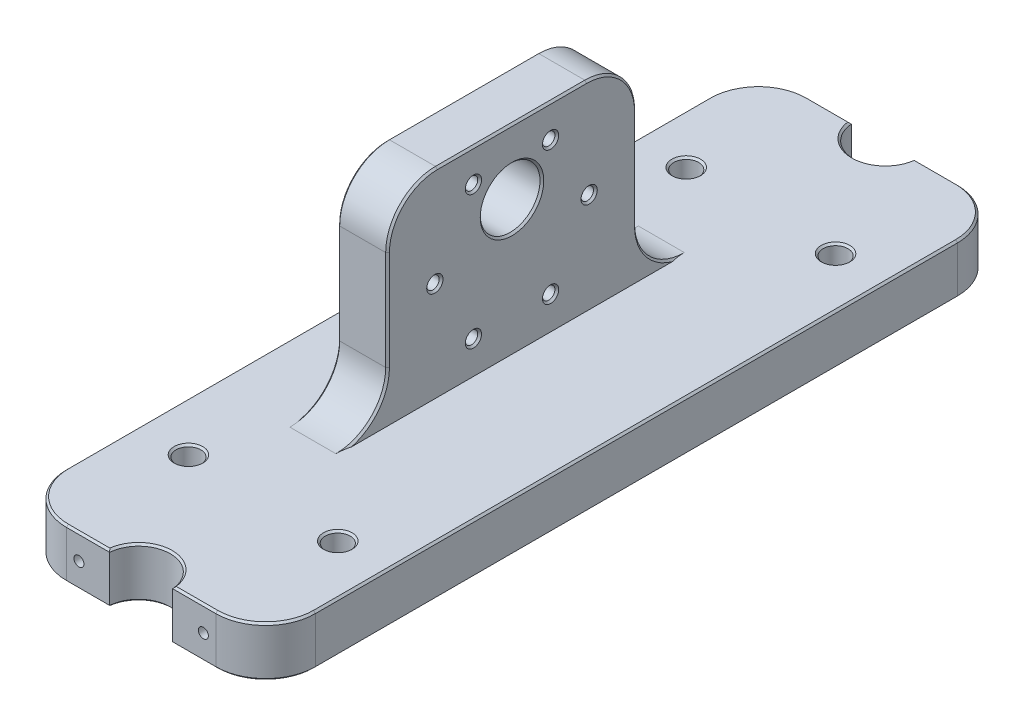
from build123d import *

# Parameters (mm, degrees)
SKETCH1_R           = 2.5
BOSS_EXTRUDE1_DEPTH = 10
SKETCH2_W           = 10
SKETCH2_H           = 50
BOSS_EXTRUDE2_DEPTH = 50
SKETCH3_R           = 1.25
SKETCH3_R_2         = 6
CUT_EXTRUDE1_DEPTH  = 103.714409895
FILLET1_R           = 10
SKETCH4_R           = 1
CUT_EXTRUDE2_DEPTH  = 5
CUT_EXTRUDE3_START  = -144
SKETCH4_2_R         = 1
CUT_EXTRUDE3_DEPTH  = 5
CHAMFER1_SIZE       = 0.381


with BuildPart() as part:
    # Sketch1 → Boss-Extrude1 (new body)
    with BuildSketch(Plane(origin=(0, 0, 0), x_dir=(1, 0, 0), z_dir=(0, 1, 0))):
        with BuildLine():
            Line((-25, 74.5), (-25, -74.5))
            Line((-25, -74.5), (-6.330284354, -74.5))
            ThreePointArc((-6.330284354, -74.5), (0, -68.65), (6.330284354, -74.5))
            Line((6.330284354, -74.5), (25, -74.5))
            Line((25, -74.5), (25, -17))
            Line((25, -17), (25, 17))
            Line((25, 17), (25, 74.5))
            Line((25, 74.5), (6.330284354, 74.5))
            ThreePointArc((6.330284354, 74.5), (0, 68.65), (-6.330284354, 74.5))
            Line((-6.330284354, 74.5), (-25, 74.5))
        make_face()
        with Locations(Location((-15, -50, 0), (0, 0, 270))):
            Circle(SKETCH1_R, mode=Mode.SUBTRACT)
        with Locations(Location((15, -50, 0), (0, 0, 270))):
            Circle(SKETCH1_R, mode=Mode.SUBTRACT)
        with Locations(Location((-15, 50, 0), (0, 0, 270))):
            Circle(SKETCH1_R, mode=Mode.SUBTRACT)
        with Locations(Location((15, 50, 0), (0, 0, 270))):
            Circle(SKETCH1_R, mode=Mode.SUBTRACT)
    extrude(amount=BOSS_EXTRUDE1_DEPTH)

    # Sketch2 → Boss-Extrude2 (add)
    with BuildSketch(Plane(origin=(0, 0, 0), x_dir=(1, 0, 0), z_dir=(0, 1, 0))):
        with Locations((-5, 0)):
            Rectangle(SKETCH2_W, SKETCH2_H)
    extrude(amount=BOSS_EXTRUDE2_DEPTH)

    # Sketch3 → Cut-Extrude1 (cut, through all)
    with BuildSketch(Plane(origin=(25, 0, 0), x_dir=(0, 0, -1), z_dir=(1, 0, 0))):
        with Locations((-15.5, 30)):
            Circle(SKETCH3_R)
        with Locations((0, 37)):
            Circle(SKETCH3_R_2)
        with Locations((-7.75, 43.423393759)):
            Circle(SKETCH3_R)
        with Locations((7.75, 43.423393759)):
            Circle(SKETCH3_R)
        with Locations((15.5, 30)):
            Circle(SKETCH3_R)
        with Locations((7.75, 16.576606241)):
            Circle(SKETCH3_R)
        with Locations((-7.75, 16.576606241)):
            Circle(SKETCH3_R)
    extrude(amount=-CUT_EXTRUDE1_DEPTH, mode=Mode.SUBTRACT)

    # Fillet1
    fillet1_edges = [part.edges().sort_by_distance(p)[0] for p in [
        (-25, 5, 74.5),
        (-25, 5, -74.5),
        (25, 5, -74.5),
        (25, 5, 74.5),
        (-5, 10, -25),
        (-5, 10, 25),
        (-5, 50, -25),
        (-5, 50, 25),
    ]]
    fillet(fillet1_edges, radius=FILLET1_R)

    # Sketch4 → Cut-Extrude2 (cut)
    with BuildSketch(Plane.XY.offset(74.5)):
        with Locations((-12.5, 5)):
            Circle(SKETCH4_R)
        with Locations((12.5, 5)):
            Circle(SKETCH4_R)
    extrude(amount=-CUT_EXTRUDE2_DEPTH, mode=Mode.SUBTRACT)

    # Sketch4<2> → Cut-Extrude3 (cut)
    with BuildSketch(Plane.XY.offset(74.5).offset(CUT_EXTRUDE3_START)):
        with Locations((-12.5, 5)):
            Circle(SKETCH4_2_R)
        with Locations((12.5, 5)):
            Circle(SKETCH4_2_R)
    extrude(amount=-CUT_EXTRUDE3_DEPTH, mode=Mode.SUBTRACT)

    # Chamfer1
    # the kernel refuses this chamfer: 0.381 mm, written as the material it takes off along each edge
    with BuildSketch(Plane(origin=(15, 10, -50), x_dir=(0, 0, 1), z_dir=(-1, 0, 0))) as chamfer1_piece_1:
        Polygon((2.5 + CHAMFER1_SIZE, 0), (2.5, -CHAMFER1_SIZE), (2.5, 0), align=None)
    revolve(axis=Axis((15, 10, -50), (0, 1, 0)), mode=Mode.SUBTRACT)
    with BuildSketch(Plane(origin=(-25, 0, -64.5), x_dir=(0.9996219169112966, -0.027495876610586445, 0), z_dir=(0, 0, 1)), Plane(origin=(25, 0, 64.5), x_dir=(-0.9996219169112966, -0.0274958766105867, 0), z_dir=(0, 0, -1)), Plane(origin=(25, 10, -64.5), x_dir=(-0.9996219169112966, 0.027495876610587368, 0), z_dir=(0, 0, 1))) as chamfer1_piece_2:
        Polygon((CHAMFER1_SIZE * 0.999621916911, CHAMFER1_SIZE * 0.0274958766106), (-CHAMFER1_SIZE * 0.0274958766106, CHAMFER1_SIZE * 0.999621916911), (0, 0), align=None)
    extrude(amount=129, mode=Mode.SUBTRACT)
    with BuildSketch(Plane(origin=(-25, 10, -64.5), x_dir=(0.9996219169112966, 0.027495876610587368, 0), z_dir=(0, 0, 1))) as chamfer1_piece_3:
        Polygon((CHAMFER1_SIZE * 0.999621916911, -CHAMFER1_SIZE * 0.0274958766106), (-CHAMFER1_SIZE * 0.0274958766106, -CHAMFER1_SIZE * 0.999621916911), (0, 0), align=None)
    extrude(amount=129, mode=Mode.SUBTRACT)
    with BuildSketch(Plane(origin=(-15, 0, 74.5), x_dir=(0, -0.027495876610586445, -0.9996219169112966), z_dir=(1, 0, 0)), Plane(origin=(-5.350473135, 0, -74.5), x_dir=(0, -0.027495876610586445, 0.9996219169112966), z_dir=(-1, 0, 0)), Plane(origin=(5.350473135, 0, 74.5), x_dir=(0, -0.027495876610586445, -0.9996219169112966), z_dir=(1, 0, 0)), Plane(origin=(15, 10, -74.5), x_dir=(0, -0.9996219169112968, -0.027495876610582715), z_dir=(-1, 0, 0))) as chamfer1_piece_4:
        Polygon((CHAMFER1_SIZE * 0.999621916911, CHAMFER1_SIZE * 0.0274958766106), (-CHAMFER1_SIZE * 0.0274958766106, CHAMFER1_SIZE * 0.999621916911), (0, 0), align=None)
    extrude(amount=9.649526865, mode=Mode.SUBTRACT)
    with BuildSketch(Plane(origin=(15, 0, 64.5), x_dir=(1, 0, 0), z_dir=(0, 0, -1))) as chamfer1_piece_5:
        Polygon((10 - CHAMFER1_SIZE, 0), (10, -CHAMFER1_SIZE), (10, 0), align=None)
    revolve(axis=Axis((15, 0, 64.5), (0, -1, 0)), revolution_arc=90, mode=Mode.SUBTRACT)
    with BuildSketch(Plane(origin=(-15, 0, 64.5), x_dir=(-1, 0, 0), z_dir=(0, 0, -1))) as chamfer1_piece_6:
        Polygon((10 - CHAMFER1_SIZE, 0), (10, CHAMFER1_SIZE), (10, 0), align=None)
    revolve(axis=Axis((-15, 0, 64.5), (0, 1, 0)), revolution_arc=90, mode=Mode.SUBTRACT)
    with BuildSketch(Plane(origin=(15, 0, -64.5), x_dir=(0, 0, -1), z_dir=(-1, 0, 0))) as chamfer1_piece_7:
        Polygon((10 - CHAMFER1_SIZE, 0), (10, -CHAMFER1_SIZE), (10, 0), align=None)
    revolve(axis=Axis((15, 0, -64.5), (0, -1, 0)), revolution_arc=90, mode=Mode.SUBTRACT)
    with BuildSketch(Plane(origin=(-15, 0, -64.5), x_dir=(0, 0, -1), z_dir=(1, 0, 0))) as chamfer1_piece_8:
        Polygon((10 - CHAMFER1_SIZE, 0), (10, CHAMFER1_SIZE), (10, 0), align=None)
    revolve(axis=Axis((-15, 0, -64.5), (0, 1, 0)), revolution_arc=90, mode=Mode.SUBTRACT)
    with BuildSketch(Plane(origin=(-5.350473135, 10, -74.5), x_dir=(0, 0.027495876610587368, 0.9996219169112966), z_dir=(-1, 0, 0)), Plane(origin=(-15, 10, 74.5), x_dir=(0, 0.027495876610587368, -0.9996219169112966), z_dir=(1, 0, 0)), Plane(origin=(15, 0, -74.5), x_dir=(0, 0.9996219169112968, -0.027495876610582753), z_dir=(-1, 0, 0)), Plane(origin=(5.350473135, 10, 74.5), x_dir=(0, 0.027495876610587368, -0.9996219169112966), z_dir=(1, 0, 0))) as chamfer1_piece_9:
        Polygon((CHAMFER1_SIZE * 0.999621916911, -CHAMFER1_SIZE * 0.0274958766106), (-CHAMFER1_SIZE * 0.0274958766106, -CHAMFER1_SIZE * 0.999621916911), (0, 0), align=None)
    extrude(amount=9.649526865, mode=Mode.SUBTRACT)
    with BuildSketch(Plane(origin=(15, 10, 64.5), x_dir=(1, 0, 0), z_dir=(0, 0, -1))) as chamfer1_piece_10:
        Polygon((10 - CHAMFER1_SIZE, 0), (10, CHAMFER1_SIZE), (10, 0), align=None)
    revolve(axis=Axis((15, 10, 64.5), (0, -1, 0)), revolution_arc=90, mode=Mode.SUBTRACT)
    with BuildSketch(Plane(origin=(-15, 10, 64.5), x_dir=(-1, 0, 0), z_dir=(0, 0, -1))) as chamfer1_piece_11:
        Polygon((10 - CHAMFER1_SIZE, 0), (10, -CHAMFER1_SIZE), (10, 0), align=None)
    revolve(axis=Axis((-15, 10, 64.5), (0, 1, 0)), revolution_arc=90, mode=Mode.SUBTRACT)
    with BuildSketch(Plane(origin=(15, 10, -64.5), x_dir=(0, 0, -1), z_dir=(-1, 0, 0))) as chamfer1_piece_12:
        Polygon((10, CHAMFER1_SIZE), (10 - CHAMFER1_SIZE, 0), (10, 0), align=None)
    revolve(axis=Axis((15, 10, -64.5), (0, -1, 0)), revolution_arc=90, mode=Mode.SUBTRACT)
    with BuildSketch(Plane(origin=(-15, 10, -64.5), x_dir=(0, 0, -1), z_dir=(1, 0, 0))) as chamfer1_piece_13:
        Polygon((10 - CHAMFER1_SIZE, 0), (10, -CHAMFER1_SIZE), (10, 0), align=None)
    revolve(axis=Axis((-15, 10, -64.5), (0, 1, 0)), revolution_arc=90, mode=Mode.SUBTRACT)
    with BuildSketch(Plane(origin=(-10, 20, -25), x_dir=(-0.027495876610587368, 0, 0.9996219169112966), z_dir=(0, 1, 0)), Plane(origin=(0, 20, 25), x_dir=(0.027495876610586268, 0, -0.9996219169112966), z_dir=(0, 1, 0))) as chamfer1_piece_14:
        Polygon((CHAMFER1_SIZE * 0.999621916911, CHAMFER1_SIZE * 0.0274958766106), (-CHAMFER1_SIZE * 0.0274958766106, CHAMFER1_SIZE * 0.999621916911), (0, 0), align=None)
    extrude(amount=20, mode=Mode.SUBTRACT)
    with BuildSketch(Plane(origin=(0, 20, -25), x_dir=(0.02749587661058663, 0, 0.9996219169112966), z_dir=(0, 1, 0)), Plane(origin=(-10, 20, 25), x_dir=(-0.027495876610587864, 0, -0.9996219169112966), z_dir=(0, 1, 0))) as chamfer1_piece_15:
        Polygon((CHAMFER1_SIZE * 0.999621916911, -CHAMFER1_SIZE * 0.0274958766106), (-CHAMFER1_SIZE * 0.0274958766106, -CHAMFER1_SIZE * 0.999621916911), (0, 0), align=None)
    extrude(amount=20, mode=Mode.SUBTRACT)
    with BuildSketch(Plane(origin=(0, 50, 15), x_dir=(0.027495876610586445, -0.9996219169112966, 0), z_dir=(0, 0, -1)), Plane(origin=(-10, 50, -15), x_dir=(-0.027495876610587368, -0.9996219169112966, 0), z_dir=(0, 0, 1))) as chamfer1_piece_16:
        Polygon((CHAMFER1_SIZE * 0.999621916911, CHAMFER1_SIZE * 0.0274958766106), (-CHAMFER1_SIZE * 0.0274958766106, CHAMFER1_SIZE * 0.999621916911), (0, 0), align=None)
    extrude(amount=30, mode=Mode.SUBTRACT)
    with BuildSketch(Plane(origin=(-10, 40, 15), x_dir=(0, 0, 1), z_dir=(0, -1, 0))) as chamfer1_piece_17:
        Polygon((10 - CHAMFER1_SIZE, 0), (10, -CHAMFER1_SIZE), (10, 0), align=None)
    revolve(axis=Axis((-10, 40, 15), (-1, 0, 0)), revolution_arc=90, mode=Mode.SUBTRACT)
    with BuildSketch(Plane(origin=(-10, 40, -15), x_dir=(0, 0, -1), z_dir=(0, -1, 0))) as chamfer1_piece_18:
        Polygon((10 - CHAMFER1_SIZE, 0), (10, CHAMFER1_SIZE), (10, 0), align=None)
    revolve(axis=Axis((-10, 40, -15), (1, 0, 0)), revolution_arc=90, mode=Mode.SUBTRACT)
    with BuildSketch(Plane(origin=(0, 40, 15), x_dir=(0, 0, 1), z_dir=(0, -1, 0))) as chamfer1_piece_19:
        Polygon((10 - CHAMFER1_SIZE, 0), (10, CHAMFER1_SIZE), (10, 0), align=None)
    revolve(axis=Axis((0, 40, 15), (-1, 0, 0)), revolution_arc=90, mode=Mode.SUBTRACT)
    with BuildSketch(Plane(origin=(0, 40, -15), x_dir=(0, 0, -1), z_dir=(0, -1, 0))) as chamfer1_piece_20:
        Polygon((10 - CHAMFER1_SIZE, 0), (10, -CHAMFER1_SIZE), (10, 0), align=None)
    revolve(axis=Axis((0, 40, -15), (1, 0, 0)), revolution_arc=90, mode=Mode.SUBTRACT)
    with BuildSketch(Plane(origin=(0, 20, -35), x_dir=(0, -0.9951998377707145, -0.09786359333860377), z_dir=(0, 0.09786359333860377, -0.9951998377707145))) as chamfer1_piece_21_section:
        Polygon((10, CHAMFER1_SIZE), (10 + CHAMFER1_SIZE, 0), (10, 0), align=None)
    chamfer1_piece_21 = revolve(axis=Axis((0, 20, -35), (-1, 0, 0)), revolution_arc=95.616159905, mode=Mode.PRIVATE)
    chamfer1_piece_21 = split(chamfer1_piece_21, bisect_by=Plane(origin=(-0.183576142, 10, -27.799124254), z_dir=(0, 1, 0)), keep=Keep.TOP, mode=Mode.PRIVATE)
    add(chamfer1_piece_21, mode=Mode.SUBTRACT)
    with BuildSketch(Plane(origin=(-10, 20, -35), x_dir=(0, -0.9951998377707145, -0.09786359333860377), z_dir=(0, 0.09786359333860377, -0.9951998377707145))) as chamfer1_piece_22_section:
        Polygon((10, -CHAMFER1_SIZE), (10 + CHAMFER1_SIZE, 0), (10, 0), align=None)
    chamfer1_piece_22 = revolve(axis=Axis((-10, 20, -35), (-1, 0, 0)), revolution_arc=95.616159905, mode=Mode.PRIVATE)
    chamfer1_piece_22 = split(chamfer1_piece_22, bisect_by=Plane(origin=(-9.816423858, 10, -27.799124254), z_dir=(0, 1, 0)), keep=Keep.TOP, mode=Mode.PRIVATE)
    add(chamfer1_piece_22, mode=Mode.SUBTRACT)
    with BuildSketch(Plane(origin=(-10, 20, 35), x_dir=(0, -0.9951998377707145, 0.09786359333860377), z_dir=(0, 0.09786359333860377, 0.9951998377707145))) as chamfer1_piece_23_section:
        Polygon((10, CHAMFER1_SIZE), (10 + CHAMFER1_SIZE, 0), (10, 0), align=None)
    chamfer1_piece_23 = revolve(axis=Axis((-10, 20, 35), (1, 0, 0)), revolution_arc=95.616159905, mode=Mode.PRIVATE)
    chamfer1_piece_23 = split(chamfer1_piece_23, bisect_by=Plane(origin=(-9.816423858, 10, 27.799124254), z_dir=(0, 1, 0)), keep=Keep.TOP, mode=Mode.PRIVATE)
    add(chamfer1_piece_23, mode=Mode.SUBTRACT)
    with BuildSketch(Plane(origin=(0, 20, 35), x_dir=(0, -0.9951998377707145, 0.09786359333860303), z_dir=(0, 0.09786359333860303, 0.9951998377707145))) as chamfer1_piece_24_section:
        Polygon((10 + CHAMFER1_SIZE, 0), (10, -CHAMFER1_SIZE), (10, 0), align=None)
    chamfer1_piece_24 = revolve(axis=Axis((0, 20, 35), (1, 0, 0)), revolution_arc=95.616159905, mode=Mode.PRIVATE)
    chamfer1_piece_24 = split(chamfer1_piece_24, bisect_by=Plane(origin=(-0.183576142, 10, 27.799124254), z_dir=(0, 1, 0)), keep=Keep.TOP, mode=Mode.PRIVATE)
    add(chamfer1_piece_24, mode=Mode.SUBTRACT)
    with BuildSketch(Plane(origin=(15, 10, 50), x_dir=(0, 0, 1), z_dir=(-1, 0, 0))) as chamfer1_piece_25:
        Polygon((2.5 + CHAMFER1_SIZE, 0), (2.5, -CHAMFER1_SIZE), (2.5, 0), align=None)
    revolve(axis=Axis((15, 10, 50), (0, 1, 0)), mode=Mode.SUBTRACT)
    with BuildSketch(Plane(origin=(0, 0, -75), x_dir=(0.9971358907761932, 0, -0.0756307829257876), z_dir=(-0.0756307829257876, 0, -0.9971358907761932))) as chamfer1_piece_26:
        Polygon((6.35 + CHAMFER1_SIZE, 0), (6.35, -CHAMFER1_SIZE), (6.35, 0), align=None)
    revolve(axis=Axis((0, 0, -75), (0, -1, 0)), revolution_arc=188.674932893, mode=Mode.SUBTRACT)
    with BuildSketch(Plane(origin=(0, 0, 75), x_dir=(-0.9971358907761962, 0, 0.07563078292574767), z_dir=(0.07563078292574767, 0, 0.9971358907761962))) as chamfer1_piece_27:
        Polygon((6.35 + CHAMFER1_SIZE, 0), (6.35, -CHAMFER1_SIZE), (6.35, 0), align=None)
    revolve(axis=Axis((0, 0, 75), (0, -1, 0)), revolution_arc=188.674932893, mode=Mode.SUBTRACT)
    with BuildSketch(Plane(origin=(-15, 0, -50), x_dir=(0, 0, 1), z_dir=(-1, 0, 0))) as chamfer1_piece_28:
        Polygon((2.5 + CHAMFER1_SIZE, 0), (2.5, CHAMFER1_SIZE), (2.5, 0), align=None)
    revolve(axis=Axis((-15, 0, -50), (0, 1, 0)), mode=Mode.SUBTRACT)
    with BuildSketch(Plane(origin=(-15, 0, 50), x_dir=(0, 0, 1), z_dir=(-1, 0, 0))) as chamfer1_piece_29:
        Polygon((2.5 + CHAMFER1_SIZE, 0), (2.5, CHAMFER1_SIZE), (2.5, 0), align=None)
    revolve(axis=Axis((-15, 0, 50), (0, 1, 0)), mode=Mode.SUBTRACT)
    with BuildSketch(Plane(origin=(15, 0, 50), x_dir=(0, 0, 1), z_dir=(-1, 0, 0))) as chamfer1_piece_30:
        Polygon((2.5 + CHAMFER1_SIZE, 0), (2.5, CHAMFER1_SIZE), (2.5, 0), align=None)
    revolve(axis=Axis((15, 0, 50), (0, 1, 0)), mode=Mode.SUBTRACT)
    with BuildSketch(Plane(origin=(15, 0, -50), x_dir=(0, 0, 1), z_dir=(-1, 0, 0))) as chamfer1_piece_31:
        Polygon((2.5 + CHAMFER1_SIZE, 0), (2.5, CHAMFER1_SIZE), (2.5, 0), align=None)
    revolve(axis=Axis((15, 0, -50), (0, 1, 0)), mode=Mode.SUBTRACT)
    with BuildSketch(Plane(origin=(-15, 10, 50), x_dir=(0, 0, 1), z_dir=(-1, 0, 0))) as chamfer1_piece_32:
        Polygon((2.5 + CHAMFER1_SIZE, 0), (2.5, -CHAMFER1_SIZE), (2.5, 0), align=None)
    revolve(axis=Axis((-15, 10, 50), (0, 1, 0)), mode=Mode.SUBTRACT)
    with BuildSketch(Plane(origin=(-15, 10, -50), x_dir=(0, 0, 1), z_dir=(-1, 0, 0))) as chamfer1_piece_33:
        Polygon((2.5 + CHAMFER1_SIZE, 0), (2.5, -CHAMFER1_SIZE), (2.5, 0), align=None)
    revolve(axis=Axis((-15, 10, -50), (0, 1, 0)), mode=Mode.SUBTRACT)
    with BuildSketch(Plane(origin=(0, 10, 75), x_dir=(-0.9971358907761962, 0, 0.07563078292574767), z_dir=(0.07563078292574767, 0, 0.9971358907761962))) as chamfer1_piece_34:
        Polygon((6.35 + CHAMFER1_SIZE, 0), (6.35, CHAMFER1_SIZE), (6.35, 0), align=None)
    revolve(axis=Axis((0, 10, 75), (0, -1, 0)), revolution_arc=188.674932893, mode=Mode.SUBTRACT)
    with BuildSketch(Plane(origin=(0, 10, -75), x_dir=(0.9971358907761932, 0, -0.0756307829257876), z_dir=(-0.0756307829257876, 0, -0.9971358907761932))) as chamfer1_piece_35:
        Polygon((6.35, CHAMFER1_SIZE), (6.35 + CHAMFER1_SIZE, 0), (6.35, 0), align=None)
    revolve(axis=Axis((0, 10, -75), (0, -1, 0)), revolution_arc=188.674932893, mode=Mode.SUBTRACT)
    with BuildSketch(Plane(origin=(-10, 30, 15.5), x_dir=(0, 0, -1), z_dir=(0, -1, 0))) as chamfer1_piece_36:
        Polygon((1.25 + CHAMFER1_SIZE, 0), (1.25, CHAMFER1_SIZE), (1.25, 0), align=None)
    revolve(axis=Axis((-10, 30, 15.5), (1, 0, 0)), mode=Mode.SUBTRACT)
    with BuildSketch(Plane(origin=(0, 30, 15.5), x_dir=(0, 0, -1), z_dir=(0, -1, 0))) as chamfer1_piece_37:
        Polygon((1.25 + CHAMFER1_SIZE, 0), (1.25, -CHAMFER1_SIZE), (1.25, 0), align=None)
    revolve(axis=Axis((0, 30, 15.5), (1, 0, 0)), mode=Mode.SUBTRACT)
    with BuildSketch(Plane(origin=(-10, 37, 0), x_dir=(0, 0, -1), z_dir=(0, -1, 0))) as chamfer1_piece_38:
        Polygon((6 + CHAMFER1_SIZE, 0), (6, CHAMFER1_SIZE), (6, 0), align=None)
    revolve(axis=Axis((-10, 37, 0), (1, 0, 0)), mode=Mode.SUBTRACT)
    with BuildSketch(Plane(origin=(0, 37, 0), x_dir=(0, 0, -1), z_dir=(0, -1, 0))) as chamfer1_piece_39:
        Polygon((6 + CHAMFER1_SIZE, 0), (6, -CHAMFER1_SIZE), (6, 0), align=None)
    revolve(axis=Axis((0, 37, 0), (1, 0, 0)), mode=Mode.SUBTRACT)
    with BuildSketch(Plane(origin=(-10, 30, -15.5), x_dir=(0, 0, -1), z_dir=(0, -1, 0))) as chamfer1_piece_40:
        Polygon((1.25 + CHAMFER1_SIZE, 0), (1.25, CHAMFER1_SIZE), (1.25, 0), align=None)
    revolve(axis=Axis((-10, 30, -15.5), (1, 0, 0)), mode=Mode.SUBTRACT)
    with BuildSketch(Plane(origin=(0, 30, -15.5), x_dir=(0, 0, -1), z_dir=(0, -1, 0))) as chamfer1_piece_41:
        Polygon((1.25 + CHAMFER1_SIZE, 0), (1.25, -CHAMFER1_SIZE), (1.25, 0), align=None)
    revolve(axis=Axis((0, 30, -15.5), (1, 0, 0)), mode=Mode.SUBTRACT)
    with BuildSketch(Plane(origin=(-10, 43.423393759, -7.75), x_dir=(0, 0, -1), z_dir=(0, -1, 0))) as chamfer1_piece_42:
        Polygon((1.25 + CHAMFER1_SIZE, 0), (1.25, CHAMFER1_SIZE), (1.25, 0), align=None)
    revolve(axis=Axis((-10, 43.423393759, -7.75), (1, 0, 0)), mode=Mode.SUBTRACT)
    with BuildSketch(Plane(origin=(0, 43.423393759, -7.75), x_dir=(0, 0, -1), z_dir=(0, -1, 0))) as chamfer1_piece_43:
        Polygon((1.25 + CHAMFER1_SIZE, 0), (1.25, -CHAMFER1_SIZE), (1.25, 0), align=None)
    revolve(axis=Axis((0, 43.423393759, -7.75), (1, 0, 0)), mode=Mode.SUBTRACT)
    with BuildSketch(Plane(origin=(-10, 43.423393759, 7.75), x_dir=(0, 0, -1), z_dir=(0, -1, 0))) as chamfer1_piece_44:
        Polygon((1.25 + CHAMFER1_SIZE, 0), (1.25, CHAMFER1_SIZE), (1.25, 0), align=None)
    revolve(axis=Axis((-10, 43.423393759, 7.75), (1, 0, 0)), mode=Mode.SUBTRACT)
    with BuildSketch(Plane(origin=(0, 43.423393759, 7.75), x_dir=(0, 0, -1), z_dir=(0, -1, 0))) as chamfer1_piece_45:
        Polygon((1.25 + CHAMFER1_SIZE, 0), (1.25, -CHAMFER1_SIZE), (1.25, 0), align=None)
    revolve(axis=Axis((0, 43.423393759, 7.75), (1, 0, 0)), mode=Mode.SUBTRACT)
    with BuildSketch(Plane(origin=(-10, 16.576606241, -7.75), x_dir=(0, 0, -1), z_dir=(0, -1, 0))) as chamfer1_piece_46:
        Polygon((1.25 + CHAMFER1_SIZE, 0), (1.25, CHAMFER1_SIZE), (1.25, 0), align=None)
    revolve(axis=Axis((-10, 16.576606241, -7.75), (1, 0, 0)), mode=Mode.SUBTRACT)
    with BuildSketch(Plane(origin=(0, 16.576606241, -7.75), x_dir=(0, 0, -1), z_dir=(0, -1, 0))) as chamfer1_piece_47:
        Polygon((1.25 + CHAMFER1_SIZE, 0), (1.25, -CHAMFER1_SIZE), (1.25, 0), align=None)
    revolve(axis=Axis((0, 16.576606241, -7.75), (1, 0, 0)), mode=Mode.SUBTRACT)
    with BuildSketch(Plane(origin=(-10, 16.576606241, 7.75), x_dir=(0, 0, -1), z_dir=(0, -1, 0))) as chamfer1_piece_48:
        Polygon((1.25 + CHAMFER1_SIZE, 0), (1.25, CHAMFER1_SIZE), (1.25, 0), align=None)
    revolve(axis=Axis((-10, 16.576606241, 7.75), (1, 0, 0)), mode=Mode.SUBTRACT)
    with BuildSketch(Plane(origin=(0, 16.576606241, 7.75), x_dir=(0, 0, -1), z_dir=(0, -1, 0))) as chamfer1_piece_49:
        Polygon((1.25 + CHAMFER1_SIZE, 0), (1.25, -CHAMFER1_SIZE), (1.25, 0), align=None)
    revolve(axis=Axis((0, 16.576606241, 7.75), (1, 0, 0)), mode=Mode.SUBTRACT)


solid = part.part
